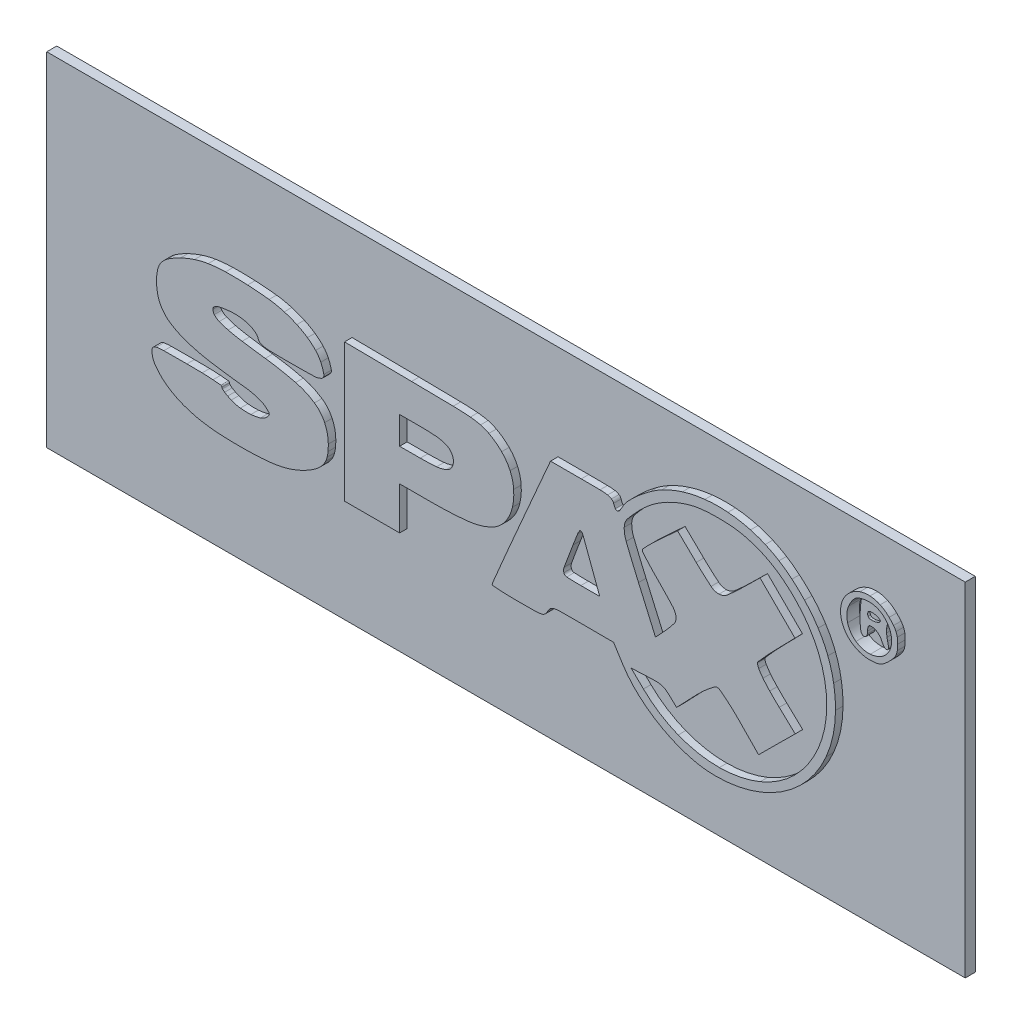
from build123d import *

# Parameters (mm, degrees)
MODEL_W                   = 367
MODEL_H                   = 137
SALIENTE_EXTRUIR1_DEPTH   = 4
SALIENTE_EXTRUIR1_2_DEPTH = 4
SALIENTE_EXTRUIR1_3_DEPTH = 4
SALIENTE_EXTRUIR1_4_DEPTH = 4
SALIENTE_EXTRUIR1_5_DEPTH = 4
SALIENTE_EXTRUIR2_DEPTH   = 7
SALIENTE_EXTRUIR2_2_DEPTH = 7
SALIENTE_EXTRUIR2_3_DEPTH = 7
SALIENTE_EXTRUIR2_4_DEPTH = 7
SALIENTE_EXTRUIR3_DEPTH   = 2
SALIENTE_EXTRUIR4_DEPTH   = 5


with BuildPart() as part:
    # Model → Saliente-Extruir1 (new body)
    with BuildSketch(Plane.XY):
        with Locations((183.5, 68.5)):
            Rectangle(MODEL_W, MODEL_H)
        with BuildLine():
            ThreePointArc((97.89509, 97.457617), (100.444776299, 96.597556375), (102.931345, 95.569169))
            ThreePointArc((102.931345, 95.569169), (105.102908707, 94.464676176), (107.166541, 93.16968))
            ThreePointArc((107.166541, 93.16968), (108.863878371, 91.861487344), (110.418396, 90.386429))
            ThreePointArc((110.418396, 90.386429), (111.583005464, 88.949287405), (112.505954, 87.34621))
            ThreePointArc((112.505954, 87.34621), (113.217849735, 85.568730482), (113.703992, 83.716733))
            ThreePointArc((113.703992, 83.716733), (113.575577736, 82.689303645), (112.860608, 81.940358))
            ThreePointArc((112.860608, 81.940358), (111.392880065, 81.363252337), (109.832213, 81.136108))
            ThreePointArc((109.832213, 81.136108), (105.215994058, 81.03402877), (100.598772, 81))
            ThreePointArc((100.598772, 81), (96.886672981, 81.012669689), (93.174747, 81.050685))
            ThreePointArc((93.174747, 81.050685), (91.591035929, 81.123910451), (90.015443, 81.300006))
            ThreePointArc((90.015443, 81.300006), (89.169923226, 81.503262558), (88.37591, 81.857889))
            ThreePointArc((88.37591, 81.857889), (87.856696942, 82.295169109), (87.534134, 82.892454))
            ThreePointArc((87.534134, 82.892454), (87.01702351, 83.919150051), (86.204428, 84.73229))
            ThreePointArc((86.204428, 84.73229), (84.940116047, 85.508200109), (83.572831, 86.083572))
            ThreePointArc((83.572831, 86.083572), (81.814884484, 86.553218974), (80.012747, 86.804704))
            ThreePointArc((80.012747, 86.804704), (77.970340474, 86.874457144), (75.929557, 86.767253))
            ThreePointArc((75.929557, 86.767253), (74.022477473, 86.535406456), (72.129489, 86.20784))
            ThreePointArc((72.129489, 86.20784), (71.024451517, 85.864619925), (70.014808, 85.299352))
            ThreePointArc((70.014808, 85.299352), (69.548951009, 84.758264963), (69.392505, 84.061614))
            ThreePointArc((69.392505, 84.061614), (69.548113908, 83.257801719), (69.95887, 82.549559))
            ThreePointArc((69.95887, 82.549559), (70.842989698, 81.718363693), (71.903523, 81.128599))
            ThreePointArc((71.903523, 81.128599), (73.664504912, 80.489747225), (75.466863, 79.979165))
            ThreePointArc((75.466863, 79.979165), (78.253261169, 79.362489292), (81.064349, 78.870464))
            ThreePointArc((81.064349, 78.870464), (85.680180626, 78.194285727), (90.303237, 77.569411))
            ThreePointArc((90.303237, 77.569411), (96.418745844, 76.605132076), (102.471757, 75.305002))
            ThreePointArc((102.471757, 75.305002), (106.362399219, 73.980036894), (109.95671, 71.986658))
            ThreePointArc((109.95671, 71.986658), (112.32428237, 69.862291851), (114.034719, 67.180364))
            ThreePointArc((114.034719, 67.180364), (115.129375106, 63.919587043), (115.5, 60.5))
            ThreePointArc((115.5, 60.5), (115.470817654, 59.176709505), (115.383327, 57.855992))
            ThreePointArc((115.383327, 57.855992), (115.244988536, 56.785136325), (115.020934, 55.728884))
            ThreePointArc((115.020934, 55.728884), (114.742516238, 54.817986978), (114.37924, 53.937487))
            ThreePointArc((114.37924, 53.937487), (113.938468483, 53.106760051), (113.418253, 52.32333))
            ThreePointArc((113.418253, 52.32333), (112.070394963, 50.762752015), (110.498998, 49.427523))
            ThreePointArc((110.498998, 49.427523), (108.317294081, 47.96880902), (106.031303, 46.679653))
            ThreePointArc((106.031303, 46.679653), (103.446783059, 45.464419834), (100.781488, 44.43839))
            ThreePointArc((100.781488, 44.43839), (98.134802313, 43.643709635), (95.433355, 43.061778))
            ThreePointArc((95.433355, 43.061778), (92.17775664, 42.589356349), (88.900642, 42.301915))
            ThreePointArc((88.900642, 42.301915), (84.743706488, 42.11463805), (80.583135, 42.045137))
            ThreePointArc((80.583135, 42.045137), (76.402918294, 42.093702528), (72.225754, 42.260642))
            ThreePointArc((72.225754, 42.260642), (68.878642284, 42.532885282), (65.55115, 42.98573))
            ThreePointArc((65.55115, 42.98573), (61.479861274, 43.858257934), (57.512985, 45.123402))
            ThreePointArc((57.512985, 45.123402), (54.090064098, 46.668098382), (50.901745, 48.65231))
            ThreePointArc((50.901745, 48.65231), (48.529453573, 50.669901915), (46.517012, 53.046564))
            ThreePointArc((46.517012, 53.046564), (45.393372944, 55.2802035), (45.003738, 57.75))
            ThreePointArc((45.003738, 57.75), (45.135261616, 58.438467642), (45.513272, 59.028717))
            ThreePointArc((45.513272, 59.028717), (46.103490165, 59.475466468), (46.805622, 59.709888))
            ThreePointArc((46.805622, 59.709888), (48.288834429, 59.891280003), (49.781497, 59.960422))
            ThreePointArc((49.781497, 59.960422), (54.390706013, 59.990107063), (59, 60))
            ThreePointArc((59, 60), (62.04361427, 59.984479082), (65.086912, 59.937921))
            ThreePointArc((65.086912, 59.937921), (67.254826602, 59.864116802), (69.419923, 59.731232))
            ThreePointArc((69.419923, 59.731232), (70.995551703, 59.59746222), (72.568268, 59.432952))
            ThreePointArc((72.568268, 59.432952), (72.876382333, 59.273252346), (73, 58.948973))
            ThreePointArc((73, 58.948973), (73.057684641, 58.675374266), (73.220918, 58.448353))
            ThreePointArc((73.220918, 58.448353), (73.645577971, 58.085215547), (74.092702, 57.750126))
            ThreePointArc((74.092702, 57.750126), (74.682415387, 57.364059421), (75.295145, 57.015675))
            ThreePointArc((75.295145, 57.015675), (75.999939345, 56.663676811), (76.719837, 56.3437))
            ThreePointArc((76.719837, 56.3437), (78.511013106, 55.736162708), (80.368573, 55.379954))
            ThreePointArc((80.368573, 55.379954), (82.471813466, 55.230523067), (84.579494, 55.290796))
            ThreePointArc((84.579494, 55.290796), (86.51708365, 55.544048629), (88.418258, 55.995631))
            ThreePointArc((88.418258, 55.995631), (89.728953262, 56.568631417), (90.853065, 57.453292))
            ThreePointArc((90.853065, 57.453292), (91.317361959, 57.95808782), (91.74725, 58.492491))
            ThreePointArc((91.74725, 58.492491), (91.895854733, 58.808705535), (91.906087, 59.157948))
            ThreePointArc((91.906087, 59.157948), (91.778876123, 59.52369892), (91.543687, 59.831339))
            ThreePointArc((91.543687, 59.831339), (90.894383482, 60.425466565), (90.224079, 60.995795))
            ThreePointArc((90.224079, 60.995795), (89.609507035, 61.432166809), (88.940389, 61.779154))
            ThreePointArc((88.940389, 61.779154), (87.963683725, 62.172095308), (86.967617, 62.512987))
            ThreePointArc((86.967617, 62.512987), (85.813367011, 62.843103226), (84.644169, 63.115584))
            ThreePointArc((84.644169, 63.115584), (83.438606069, 63.336014829), (82.224079, 63.500014))
            ThreePointArc((82.224079, 63.500014), (75.12384142, 64.383742012), (68.048812, 65.450657))
            ThreePointArc((68.048812, 65.450657), (63.3281745, 66.421483701), (58.700849, 67.768622))
            ThreePointArc((58.700849, 67.768622), (55.518991635, 69.062756809), (52.524172, 70.745034))
            ThreePointArc((52.524172, 70.745034), (50.386098374, 72.515983093), (48.717788, 74.735073))
            ThreePointArc((48.717788, 74.735073), (47.880504769, 76.469220421), (47.321521, 78.312003))
            ThreePointArc((47.321521, 78.312003), (46.969167844, 80.457753628), (46.850641, 82.629009))
            ThreePointArc((46.850641, 82.629009), (46.965997341, 84.725026768), (47.312436, 86.795432))
            ThreePointArc((47.312436, 86.795432), (47.854451459, 88.418610872), (48.711347, 89.899901))
            ThreePointArc((48.711347, 89.899901), (50.000998097, 91.380885307), (51.537218, 92.604218))
            ThreePointArc((51.537218, 92.604218), (53.912861215, 94.055494269), (56.379506, 95.346055))
            ThreePointArc((56.379506, 95.346055), (59.164667649, 96.577750213), (62.023915, 97.626036))
            ThreePointArc((62.023915, 97.626036), (64.736876752, 98.400613662), (67.503968, 98.951375))
            ThreePointArc((67.503968, 98.951375), (70.959690911, 99.373379491), (74.436153, 99.558636))
            ThreePointArc((74.436153, 99.558636), (78.841896801, 99.567658734), (83.245386, 99.42644))
            ThreePointArc((83.245386, 99.42644), (87.543611742, 99.142488444), (91.829825, 98.713829))
            ThreePointArc((91.829825, 98.713829), (94.890016279, 98.218782784), (97.89509, 97.457617))
        make_face(mode=Mode.SUBTRACT)
        with BuildLine():
            ThreePointArc((171.275076, 61.718433), (164.306026908, 61.179727941), (157.318499, 61))
            Line((157.318499, 61), (144, 61))
            Line((144, 61), (144, 44))
            Line((144, 44), (122, 44))
            Line((122, 44), (122, 99.119291))
            Line((122, 99.119291), (148.75, 98.809646))
            ThreePointArc((148.75, 98.809646), (157.081469734, 98.700396012), (165.412564, 98.565519))
            ThreePointArc((165.412564, 98.565519), (168.835102049, 98.450039203), (172.252192, 98.225098))
            ThreePointArc((172.252192, 98.225098), (174.30257356, 97.973610726), (176.326044, 97.557825))
            ThreePointArc((176.326044, 97.557825), (178.030501311, 97.021242966), (179.655474, 96.2779))
            ThreePointArc((179.655474, 96.2779), (182.352634405, 94.570847489), (184.771872, 92.488543))
            ThreePointArc((184.771872, 92.488543), (186.67614225, 90.209938725), (188.137833, 87.625032))
            ThreePointArc((188.137833, 87.625032), (189.116328654, 84.803619752), (189.573535, 81.852555))
            ThreePointArc((189.573535, 81.852555), (189.549890982, 78.616931261), (189.068878, 75.417174))
            ThreePointArc((189.068878, 75.417174), (187.853250507, 71.848145284), (185.900182, 68.62305))
            ThreePointArc((185.900182, 68.62305), (183.373056049, 66.045983765), (180.294502, 64.161802))
            ThreePointArc((180.294502, 64.161802), (175.8837711, 62.574736043), (171.275076, 61.718433))
        make_face(mode=Mode.SUBTRACT)
        with BuildLine():
            ThreePointArc((239.779111, 35.375969), (236.105882636, 39.12266297), (233, 43.351589))
            Line((233, 43.351589), (229.5, 48.903895))
            Line((229.5, 48.903895), (216.910515, 48.951948))
            ThreePointArc((216.910515, 48.951948), (212.779724601, 48.956111332), (208.648976, 48.937068))
            ThreePointArc((208.648976, 48.937068), (207.213960958, 48.865618775), (205.790127, 48.673083))
            ThreePointArc((205.790127, 48.673083), (204.981735104, 48.413893271), (204.270399, 47.95056))
            ThreePointArc((204.270399, 47.95056), (203.647464763, 47.284342291), (203.181954, 46.5))
            ThreePointArc((203.181954, 46.5), (202.738611643, 45.731923216), (202.156892, 45.062523))
            ThreePointArc((202.156892, 45.062523), (201.518577712, 44.60455888), (200.780131, 44.336468))
            ThreePointArc((200.780131, 44.336468), (199.53409447, 44.132552343), (198.274087, 44.051498))
            ThreePointArc((198.274087, 44.051498), (194.897861181, 44.012875077), (191.521439, 44))
            ThreePointArc((191.521439, 44), (189.504137229, 44.012675794), (187.487154, 44.050699))
            ThreePointArc((187.487154, 44.050699), (185.788096336, 44.111177481), (184.090673, 44.207139))
            ThreePointArc((184.090673, 44.207139), (182.675308241, 44.308135781), (181.260868, 44.421346))
            ThreePointArc((181.260868, 44.421346), (181.075124451, 44.512411762), (181, 44.705155))
            ThreePointArc((181, 44.705155), (181.027607758, 44.980527094), (181.109332, 45.244938))
            Line((181.109332, 45.244938), (184.420522, 53.074156))
            ThreePointArc((184.420522, 53.074156), (186.293976623, 57.480794427), (188.180229, 61.88197))
            Line((188.180229, 61.88197), (192.644331, 72.205155))
            Line((192.644331, 72.205155), (204.288661, 99))
            Line((204.288661, 99), (216.576943, 99))
            ThreePointArc((216.576943, 99), (220.317245151, 98.987606089), (224.057383, 98.950422))
            ThreePointArc((224.057383, 98.950422), (225.581249488, 98.876721039), (227.096203, 98.696397))
            ThreePointArc((227.096203, 98.696397), (227.906918414, 98.482262304), (228.65542, 98.104296))
            ThreePointArc((228.65542, 98.104296), (229.174077495, 97.625851118), (229.5, 97))
            ThreePointArc((229.5, 97), (229.798344799, 96.221330865), (230.185638, 95.48286))
            ThreePointArc((230.185638, 95.48286), (230.523537363, 95.180947078), (230.972891, 95.122563))
            ThreePointArc((230.972891, 95.122563), (231.489196338, 95.321864885), (231.888979, 95.704574))
            ThreePointArc((231.888979, 95.704574), (232.503281328, 96.642068308), (233.061127, 97.614216))
            ThreePointArc((233.061127, 97.614216), (234.074201552, 99.231212662), (235.29801, 100.695211))
            ThreePointArc((235.29801, 100.695211), (237.291847949, 102.683108862), (239.37243, 104.580029))
            ThreePointArc((239.37243, 104.580029), (241.704789564, 106.52210935), (244.122461, 108.356896))
            ThreePointArc((244.122461, 108.356896), (246.357881525, 109.868303172), (248.685597, 111.233293))
            ThreePointArc((248.685597, 111.233293), (252.75506448, 113.19239205), (256.998615, 114.73865))
            ThreePointArc((256.998615, 114.73865), (261.438425803, 115.883547559), (265.966723, 116.602738))
            ThreePointArc((265.966723, 116.602738), (270.566138345, 116.892392642), (275.172384, 116.747402))
            ThreePointArc((275.172384, 116.747402), (279.718965517, 116.16866996), (284.189216, 115.157139))
            ThreePointArc((284.189216, 115.157139), (287.176762343, 114.213297932), (290.089809, 113.059856))
            ThreePointArc((290.089809, 113.059856), (292.881459471, 111.714058106), (295.566942, 110.167233))
            ThreePointArc((295.566942, 110.167233), (298.2248954, 108.370147666), (300.749659, 106.390299))
            ThreePointArc((300.749659, 106.390299), (303.327516064, 104.090218723), (305.771367, 101.64823))
            ThreePointArc((305.771367, 101.64823), (308.656650042, 98.29891621), (311.218992, 94.696533))
            ThreePointArc((311.218992, 94.696533), (313.357733991, 90.971837627), (315.1092, 87.050111))
            ThreePointArc((315.1092, 87.050111), (316.470901091, 82.932614249), (317.414446, 78.69968))
            ThreePointArc((317.414446, 78.69968), (317.98346645, 74.195289034), (318.15781, 69.658448))
            ThreePointArc((318.15781, 69.658448), (317.190509028, 60.526349584), (314.422737, 51.77019))
            ThreePointArc((314.422737, 51.77019), (309.952116696, 43.681081751), (303.985801, 36.622527))
            ThreePointArc((303.985801, 36.622527), (296.700003431, 30.811535346), (288.427385, 26.520352))
            ThreePointArc((288.427385, 26.520352), (279.43924588, 23.885002503), (270.11351, 23.011869))
            ThreePointArc((270.11351, 23.011869), (264.818740399, 23.392292132), (259.626977, 24.499044))
            ThreePointArc((259.626977, 24.499044), (254.230732451, 26.375908187), (249.075793, 28.839376))
            ThreePointArc((249.075793, 28.839376), (244.245100665, 31.848322962), (239.779111, 35.375969))
        make_face(mode=Mode.SUBTRACT)
        with BuildLine():
            ThreePointArc((339.6, 112.6), (340.501822247, 111.65073337), (341.353833, 110.656516))
            ThreePointArc((341.353833, 110.656516), (341.902405139, 109.883771356), (342.345238, 109.045938))
            ThreePointArc((342.345238, 109.045938), (342.655044194, 108.196448038), (342.841588, 107.31168))
            ThreePointArc((342.841588, 107.31168), (342.960350312, 106.158550667), (343, 105))
            ThreePointArc((343, 105), (342.960350312, 103.841449333), (342.841588, 102.68832))
            ThreePointArc((342.841588, 102.68832), (342.655044194, 101.803551962), (342.345238, 100.954062))
            ThreePointArc((342.345238, 100.954062), (341.902405139, 100.116228644), (341.353833, 99.343484))
            ThreePointArc((341.353833, 99.343484), (340.501822247, 98.34926663), (339.6, 97.4))
            ThreePointArc((339.6, 97.4), (338.632669788, 96.480907495), (337.619632, 95.612453))
            ThreePointArc((337.619632, 95.612453), (336.844834079, 95.065887145), (336.002408, 94.630727))
            ThreePointArc((336.002408, 94.630727), (335.130146874, 94.326044941), (334.2232, 94.149642))
            ThreePointArc((334.2232, 94.149642), (332.981277198, 94.037444874), (331.734859, 94))
            ThreePointArc((331.734859, 94), (328.290479936, 94.501704687), (325.132342, 95.965132))
            ThreePointArc((325.132342, 95.965132), (322.604525834, 98.241866266), (320.889488, 101.179896))
            ThreePointArc((320.889488, 101.179896), (320.174732681, 104.450317237), (320.515643, 107.780529))
            ThreePointArc((320.515643, 107.780529), (321.877799547, 110.886710221), (324.11073, 113.439719))
            ThreePointArc((324.11073, 113.439719), (325.880428663, 114.677067568), (327.841843, 115.580239))
            ThreePointArc((327.841843, 115.580239), (329.865763169, 116.082200887), (331.948897, 116.17586))
            ThreePointArc((331.948897, 116.17586), (334.02942473, 115.857120166), (336.008244, 115.139858))
            ThreePointArc((336.008244, 115.139858), (337.912262804, 114.022856991), (339.6, 112.6))
        make_face(mode=Mode.SUBTRACT)
    extrude(amount=SALIENTE_EXTRUIR1_DEPTH)



with BuildPart() as body_2:
    # Model → Saliente-Extruir1 2 (new body)
    with BuildSketch(Plane.XY):
        with BuildLine():
            ThreePointArc((234.51169, 86.356391), (236.939993562, 80.440385504), (239.4571, 74.561614))
            Line((239.4571, 74.561614), (246.22639, 59.075076))
            Line((246.22639, 59.075076), (250.110038, 63.239911))
            ThreePointArc((250.110038, 63.239911), (251.987653471, 65.369915405), (253.743234, 67.601573))
            ThreePointArc((253.743234, 67.601573), (254.341002642, 68.851587105), (254.425489, 70.2346))
            ThreePointArc((254.425489, 70.2346), (254.00299519, 71.706076314), (253.169425, 72.990173))
            ThreePointArc((253.169425, 72.990173), (250.676788874, 75.728790617), (248.105547, 78.393744))
            ThreePointArc((248.105547, 78.393744), (246.736411979, 79.787007115), (245.382367, 81.19494))
            ThreePointArc((245.382367, 81.19494), (244.224550826, 82.43211461), (243.087254, 83.688178))
            ThreePointArc((243.087254, 83.688178), (242.138178293, 84.761898494), (241.197141, 85.842671))
            ThreePointArc((241.197141, 85.842671), (241.050883489, 86.089738417), (241, 86.372306))
            ThreePointArc((241, 86.372306), (241.082897444, 86.82059458), (241.320626, 87.209593))
            ThreePointArc((241.320626, 87.209593), (242.238293761, 88.208933851), (243.178507, 89.187093))
            ThreePointArc((243.178507, 89.187093), (244.644951364, 90.646871396), (246.14217, 92.075069))
            ThreePointArc((246.14217, 92.075069), (248.704344592, 94.455833269), (251.278102, 96.824071))
            Line((251.278102, 96.824071), (255.056204, 100.283501))
            Line((255.056204, 100.283501), (262.500164, 93.065496))
            ThreePointArc((262.500164, 93.065496), (265.419029622, 90.344013715), (268.442154, 87.738834))
            ThreePointArc((268.442154, 87.738834), (269.934218851, 86.906898932), (271.625227, 86.664278))
            ThreePointArc((271.625227, 86.664278), (273.349125796, 87.029016869), (274.856476, 87.941572))
            ThreePointArc((274.856476, 87.941572), (278.099840365, 90.833381683), (281.25, 93.826452))
            Line((281.25, 93.826452), (288, 100.446361))
            Line((288, 100.446361), (294.977731, 93.522098))
            Line((294.977731, 93.522098), (301.955463, 86.597835))
            Line((301.955463, 86.597835), (294.477731, 78.913754))
            ThreePointArc((294.477731, 78.913754), (293.038471082, 77.422482094), (291.611599, 75.919353))
            ThreePointArc((291.611599, 75.919353), (290.39561254, 74.610931763), (289.196584, 73.286953))
            ThreePointArc((289.196584, 73.286953), (288.179881049, 72.144274894), (287.168553, 70.996837))
            ThreePointArc((287.168553, 70.996837), (287.043533769, 70.788303649), (287, 70.549095))
            ThreePointArc((287, 70.549095), (287.121205099, 69.649345269), (287.476178, 68.813741))
            ThreePointArc((287.476178, 68.813741), (288.287068081, 67.542884725), (289.178372, 66.327074))
            ThreePointArc((289.178372, 66.327074), (290.480929376, 64.751633309), (291.863447, 63.245873))
            ThreePointArc((291.863447, 63.245873), (293.741562948, 61.349481392), (295.664123, 59.498162))
            Line((295.664123, 59.498162), (302.046691, 53.496324))
            Line((302.046691, 53.496324), (294.733946, 46.232385))
            Line((294.733946, 46.232385), (287.421202, 38.968446))
            Line((287.421202, 38.968446), (280.081295, 46.484223))
            ThreePointArc((280.081295, 46.484223), (278.625025699, 47.94091597), (277.135093, 49.363159))
            ThreePointArc((277.135093, 49.363159), (275.764522774, 50.600242631), (274.354565, 51.79224))
            ThreePointArc((274.354565, 51.79224), (273.171155452, 52.735404251), (271.964155, 53.648184))
            ThreePointArc((271.964155, 53.648184), (271.45680364, 53.909793445), (270.893148, 54))
            ThreePointArc((270.893148, 54), (270.331449049, 53.909128763), (269.827055, 53.645785))
            ThreePointArc((269.827055, 53.645785), (268.638485823, 52.733564375), (267.474115, 51.790652))
            ThreePointArc((267.474115, 51.790652), (266.08707827, 50.597824574), (264.740216, 49.359814))
            ThreePointArc((264.740216, 49.359814), (263.277579752, 47.936544949), (261.849285, 46.478816))
            Line((261.849285, 46.478816), (254.653661, 38.957632))
            Line((254.653661, 38.957632), (251.968468, 41.53021))
            ThreePointArc((251.968468, 41.53021), (251.134217606, 42.265198483), (250.241566, 42.928037))
            ThreePointArc((250.241566, 42.928037), (249.488627397, 43.348228458), (248.673779, 43.630185))
            ThreePointArc((248.673779, 43.630185), (247.64971719, 43.821064065), (246.61005, 43.886099))
            ThreePointArc((246.61005, 43.886099), (244.750328485, 43.866376755), (242.891638, 43.801394))
            Line((242.891638, 43.801394), (236.5, 43.5))
            Line((236.5, 43.5), (241.42227, 38.718865))
            ThreePointArc((241.42227, 38.718865), (247.919417785, 33.549751628), (255.304942, 29.756772))
            ThreePointArc((255.304942, 29.756772), (263.371500003, 27.43740264), (271.731922, 26.694317))
            ThreePointArc((271.731922, 26.694317), (280.079454103, 27.554658545), (288.110944, 29.987075))
            ThreePointArc((288.110944, 29.987075), (295.43831678, 33.88293459), (301.857143, 39.142857))
            ThreePointArc((301.857143, 39.142857), (307.264262026, 45.711138026), (311.308773, 53.195868))
            ThreePointArc((311.308773, 53.195868), (313.800570664, 61.25849054), (314.657457, 69.653768))
            ThreePointArc((314.657457, 69.653768), (313.845493433, 78.039631654), (311.396176, 86.100825))
            ThreePointArc((311.396176, 86.100825), (307.394951704, 93.571510472), (302.02185, 100.12519))
            ThreePointArc((302.02185, 100.12519), (299.793273975, 102.241903239), (297.454132, 104.235754))
            ThreePointArc((297.454132, 104.235754), (295.232852331, 105.898153627), (292.896209, 107.394066))
            ThreePointArc((292.896209, 107.394066), (290.503237925, 108.687447768), (288.02024, 109.798244))
            ThreePointArc((288.02024, 109.798244), (285.288271903, 110.803794267), (282.5, 111.640646))
            ThreePointArc((282.5, 111.640646), (279.96076598, 112.209018845), (277.383638, 112.568419))
            ThreePointArc((277.383638, 112.568419), (274.29915905, 112.794914592), (271.207297, 112.870411))
            ThreePointArc((271.207297, 112.870411), (268.125347626, 112.794890196), (265.050782, 112.568701))
            ThreePointArc((265.050782, 112.568701), (262.505889422, 112.21038982), (260, 111.639966))
            ThreePointArc((260, 111.639966), (257.253357478, 110.798501546), (254.565122, 109.785833))
            ThreePointArc((254.565122, 109.785833), (251.974835187, 108.61580809), (249.466042, 107.279956))
            ThreePointArc((249.466042, 107.279956), (247.067791784, 105.794491212), (244.771966, 104.155164))
            ThreePointArc((244.771966, 104.155164), (242.597300254, 102.37492684), (240.545309, 100.454576))
            ThreePointArc((240.545309, 100.454576), (237.771874557, 97.544481246), (235.141444, 94.50451))
            ThreePointArc((235.141444, 94.50451), (234.142657499, 92.789858214), (233.741004, 90.846593))
            ThreePointArc((233.741004, 90.846593), (233.887490705, 88.560495358), (234.51169, 86.356391))
        make_face()
    extrude(amount=SALIENTE_EXTRUIR1_2_DEPTH)


with BuildPart() as body_3:
    # Model → Saliente-Extruir1 3 (new body)
    with BuildSketch(Plane.XY):
        with BuildLine():
            ThreePointArc((210.745781, 62.148912), (213.575640978, 62.037233298), (216.407459, 62))
            Line((216.407459, 62), (223.949694, 62))
            Line((223.949694, 62), (221.063652, 69.75))
            Line((221.063652, 69.75), (219.890024, 72.897158))
            Line((219.890024, 72.897158), (218.750176, 75.94473))
            Line((218.750176, 75.94473), (217.77347, 78.548354))
            Line((217.77347, 78.548354), (217.240727, 79.955464))
            ThreePointArc((217.240727, 79.955464), (216.980093899, 80.439013159), (216.604024, 80.839414))
            ThreePointArc((216.604024, 80.839414), (216.269421607, 80.935209877), (215.970403, 80.757099))
            ThreePointArc((215.970403, 80.757099), (215.506154055, 80.023375365), (215.135296, 79.238301))
            ThreePointArc((215.135296, 79.238301), (214.192446019, 76.850464083), (213.267943, 74.455464))
            ThreePointArc((213.267943, 74.455464), (211.477410462, 69.723514285), (209.713528, 64.981566))
            ThreePointArc((209.713528, 64.981566), (209.519260228, 64.038945584), (209.612337, 63.081026))
            ThreePointArc((209.612337, 63.081026), (210.025738364, 62.428532197), (210.745781, 62.148912))
        make_face()
    extrude(amount=SALIENTE_EXTRUIR1_3_DEPTH)


with BuildPart() as body_4:
    # Model → Saliente-Extruir1 4 (new body)
    with BuildSketch(Plane.XY):
        with BuildLine():
            Line((144, 85), (144, 74))
            Line((144, 74), (152.25, 74.014742))
            ThreePointArc((152.25, 74.014742), (155.509024671, 74.08445091), (158.762814, 74.281824))
            ThreePointArc((158.762814, 74.281824), (160.735248024, 74.596622292), (162.634723, 75.214351))
            ThreePointArc((162.634723, 75.214351), (163.802916508, 75.914163807), (164.717742, 76.92288))
            ThreePointArc((164.717742, 76.92288), (165.5, 79.5), (164.717742, 82.07712))
            ThreePointArc((164.717742, 82.07712), (163.802916508, 83.085836193), (162.634723, 83.785649))
            ThreePointArc((162.634723, 83.785649), (160.735248024, 84.403377708), (158.762814, 84.718176))
            ThreePointArc((158.762814, 84.718176), (155.509024671, 84.91554909), (152.25, 84.985258))
            Line((152.25, 84.985258), (144, 85))
        make_face()
    extrude(amount=SALIENTE_EXTRUIR1_4_DEPTH)


with BuildPart() as body_5:
    # Model → Saliente-Extruir1 5 (new body)
    with BuildSketch(Plane.XY):
        with BuildLine():
            ThreePointArc((329.156275, 108.222533), (329.039515006, 107.86962007), (329, 107.5))
            ThreePointArc((329, 107.5), (329.039515221, 107.130379976), (329.156275, 106.777467))
            ThreePointArc((329.156275, 106.777467), (329.33435515, 106.512823122), (329.589081, 106.320824))
            ThreePointArc((329.589081, 106.320824), (329.960480225, 106.178664013), (330.354404, 106.124158))
            ThreePointArc((330.354404, 106.124158), (330.943844998, 106.132114624), (331.531089, 106.183578))
            ThreePointArc((331.531089, 106.183578), (332.019211122, 106.262948528), (332.50017, 106.37802))
            ThreePointArc((332.50017, 106.37802), (332.917817809, 106.518116787), (333.318671, 106.700801))
            ThreePointArc((333.318671, 106.700801), (333.613259513, 106.879049322), (333.882451, 107.093737))
            ThreePointArc((333.882451, 107.093737), (334.062179, 107.5), (333.882451, 107.906263))
            ThreePointArc((333.882451, 107.906263), (333.613259513, 108.120950678), (333.318671, 108.299199))
            ThreePointArc((333.318671, 108.299199), (332.917817809, 108.481883213), (332.50017, 108.62198))
            ThreePointArc((332.50017, 108.62198), (332.019211122, 108.737051472), (331.531089, 108.816422))
            ThreePointArc((331.531089, 108.816422), (330.943844998, 108.867885376), (330.354404, 108.875842))
            ThreePointArc((330.354404, 108.875842), (329.960480225, 108.821335987), (329.589081, 108.679176))
            ThreePointArc((329.589081, 108.679176), (329.33435515, 108.487176878), (329.156275, 108.222533))
        make_face()
    extrude(amount=SALIENTE_EXTRUIR1_5_DEPTH)


with BuildPart() as body_6:
    # Model<3> → Saliente-Extruir2 (new body)
    with BuildSketch(Plane.XY):
        with BuildLine():
            Line((229.5, 48.903895), (233, 43.351589))
            ThreePointArc((233, 43.351589), (236.105882636, 39.12266297), (239.779111, 35.375969))
            ThreePointArc((239.779111, 35.375969), (244.245100665, 31.848322962), (249.075793, 28.839376))
            ThreePointArc((249.075793, 28.839376), (254.230732451, 26.375908187), (259.626977, 24.499044))
            ThreePointArc((259.626977, 24.499044), (264.818740399, 23.392292132), (270.11351, 23.011869))
            ThreePointArc((270.11351, 23.011869), (279.43924588, 23.885002503), (288.427385, 26.520352))
            ThreePointArc((288.427385, 26.520352), (296.700003431, 30.811535346), (303.985801, 36.622527))
            ThreePointArc((303.985801, 36.622527), (309.952116696, 43.681081751), (314.422737, 51.77019))
            ThreePointArc((314.422737, 51.77019), (317.190509028, 60.526349584), (318.15781, 69.658448))
            ThreePointArc((318.15781, 69.658448), (317.98346645, 74.195289034), (317.414446, 78.69968))
            ThreePointArc((317.414446, 78.69968), (316.470901091, 82.932614249), (315.1092, 87.050111))
            ThreePointArc((315.1092, 87.050111), (313.357733991, 90.971837627), (311.218992, 94.696533))
            ThreePointArc((311.218992, 94.696533), (308.656650042, 98.29891621), (305.771367, 101.64823))
            ThreePointArc((305.771367, 101.64823), (303.327516064, 104.090218723), (300.749659, 106.390299))
            ThreePointArc((300.749659, 106.390299), (298.2248954, 108.370147666), (295.566942, 110.167233))
            ThreePointArc((295.566942, 110.167233), (292.881459471, 111.714058106), (290.089809, 113.059856))
            ThreePointArc((290.089809, 113.059856), (287.176762343, 114.213297932), (284.189216, 115.157139))
            ThreePointArc((284.189216, 115.157139), (279.718965517, 116.16866996), (275.172384, 116.747402))
            ThreePointArc((275.172384, 116.747402), (270.566138345, 116.892392642), (265.966723, 116.602738))
            ThreePointArc((265.966723, 116.602738), (261.438425803, 115.883547559), (256.998615, 114.73865))
            ThreePointArc((256.998615, 114.73865), (252.75506448, 113.19239205), (248.685597, 111.233293))
            ThreePointArc((248.685597, 111.233293), (246.357881525, 109.868303172), (244.122461, 108.356896))
            ThreePointArc((244.122461, 108.356896), (241.704789564, 106.52210935), (239.37243, 104.580029))
            ThreePointArc((239.37243, 104.580029), (237.291847949, 102.683108862), (235.29801, 100.695211))
            ThreePointArc((235.29801, 100.695211), (234.074201552, 99.231212662), (233.061127, 97.614216))
            ThreePointArc((233.061127, 97.614216), (232.503281328, 96.642068308), (231.888979, 95.704574))
            ThreePointArc((231.888979, 95.704574), (231.489196338, 95.321864885), (230.972891, 95.122563))
            ThreePointArc((230.972891, 95.122563), (230.523537363, 95.180947078), (230.185638, 95.48286))
            ThreePointArc((230.185638, 95.48286), (229.798344799, 96.221330865), (229.5, 97))
            ThreePointArc((229.5, 97), (229.174077495, 97.625851118), (228.65542, 98.104296))
            ThreePointArc((228.65542, 98.104296), (227.906918414, 98.482262304), (227.096203, 98.696397))
            ThreePointArc((227.096203, 98.696397), (225.581249488, 98.876721039), (224.057383, 98.950422))
            ThreePointArc((224.057383, 98.950422), (220.317245151, 98.987606089), (216.576943, 99))
            Line((216.576943, 99), (204.288661, 99))
            Line((204.288661, 99), (192.644331, 72.205155))
            Line((192.644331, 72.205155), (188.180229, 61.88197))
            ThreePointArc((188.180229, 61.88197), (186.293976623, 57.480794427), (184.420522, 53.074156))
            Line((184.420522, 53.074156), (181.109332, 45.244938))
            ThreePointArc((181.109332, 45.244938), (181.027607758, 44.980527094), (181, 44.705155))
            ThreePointArc((181, 44.705155), (181.075124451, 44.512411762), (181.260868, 44.421346))
            ThreePointArc((181.260868, 44.421346), (182.675308241, 44.308135781), (184.090673, 44.207139))
            ThreePointArc((184.090673, 44.207139), (185.788096336, 44.111177481), (187.487154, 44.050699))
            ThreePointArc((187.487154, 44.050699), (189.504137229, 44.012675794), (191.521439, 44))
            ThreePointArc((191.521439, 44), (194.897861181, 44.012875077), (198.274087, 44.051498))
            ThreePointArc((198.274087, 44.051498), (199.53409447, 44.132552343), (200.780131, 44.336468))
            ThreePointArc((200.780131, 44.336468), (201.518577712, 44.60455888), (202.156892, 45.062523))
            ThreePointArc((202.156892, 45.062523), (202.738611643, 45.731923216), (203.181954, 46.5))
            ThreePointArc((203.181954, 46.5), (203.647464763, 47.284342291), (204.270399, 47.95056))
            ThreePointArc((204.270399, 47.95056), (204.981735104, 48.413893271), (205.790127, 48.673083))
            ThreePointArc((205.790127, 48.673083), (207.213960958, 48.865618775), (208.648976, 48.937068))
            ThreePointArc((208.648976, 48.937068), (212.779724601, 48.956111332), (216.910515, 48.951948))
            Line((216.910515, 48.951948), (229.5, 48.903895))
        make_face()
        with BuildLine():
            Line((223.949694, 62), (216.407459, 62))
            ThreePointArc((216.407459, 62), (213.575640978, 62.037233298), (210.745781, 62.148912))
            ThreePointArc((210.745781, 62.148912), (210.025738364, 62.428532197), (209.612337, 63.081026))
            ThreePointArc((209.612337, 63.081026), (209.519260228, 64.038945584), (209.713528, 64.981566))
            ThreePointArc((209.713528, 64.981566), (211.477410462, 69.723514285), (213.267943, 74.455464))
            ThreePointArc((213.267943, 74.455464), (214.192446019, 76.850464083), (215.135296, 79.238301))
            ThreePointArc((215.135296, 79.238301), (215.506154055, 80.023375365), (215.970403, 80.757099))
            ThreePointArc((215.970403, 80.757099), (216.269421607, 80.935209877), (216.604024, 80.839414))
            ThreePointArc((216.604024, 80.839414), (216.980093899, 80.439013159), (217.240727, 79.955464))
            Line((217.240727, 79.955464), (217.77347, 78.548354))
            Line((217.77347, 78.548354), (218.750176, 75.94473))
            Line((218.750176, 75.94473), (219.890024, 72.897158))
            Line((219.890024, 72.897158), (221.063652, 69.75))
            Line((221.063652, 69.75), (223.949694, 62))
        make_face(mode=Mode.SUBTRACT)
        with BuildLine():
            Line((246.22639, 59.075076), (239.4571, 74.561614))
            ThreePointArc((239.4571, 74.561614), (236.939993562, 80.440385504), (234.51169, 86.356391))
            ThreePointArc((234.51169, 86.356391), (233.887490705, 88.560495358), (233.741004, 90.846593))
            ThreePointArc((233.741004, 90.846593), (234.142657499, 92.789858214), (235.141444, 94.50451))
            ThreePointArc((235.141444, 94.50451), (237.771874557, 97.544481246), (240.545309, 100.454576))
            ThreePointArc((240.545309, 100.454576), (242.597300254, 102.37492684), (244.771966, 104.155164))
            ThreePointArc((244.771966, 104.155164), (247.067791784, 105.794491212), (249.466042, 107.279956))
            ThreePointArc((249.466042, 107.279956), (251.974835187, 108.61580809), (254.565122, 109.785833))
            ThreePointArc((254.565122, 109.785833), (257.253357478, 110.798501546), (260, 111.639966))
            ThreePointArc((260, 111.639966), (262.505889422, 112.21038982), (265.050782, 112.568701))
            ThreePointArc((265.050782, 112.568701), (268.125347626, 112.794890196), (271.207297, 112.870411))
            ThreePointArc((271.207297, 112.870411), (274.29915905, 112.794914592), (277.383638, 112.568419))
            ThreePointArc((277.383638, 112.568419), (279.96076598, 112.209018845), (282.5, 111.640646))
            ThreePointArc((282.5, 111.640646), (285.288271903, 110.803794267), (288.02024, 109.798244))
            ThreePointArc((288.02024, 109.798244), (290.503237925, 108.687447768), (292.896209, 107.394066))
            ThreePointArc((292.896209, 107.394066), (295.232852331, 105.898153627), (297.454132, 104.235754))
            ThreePointArc((297.454132, 104.235754), (299.793273975, 102.241903239), (302.02185, 100.12519))
            ThreePointArc((302.02185, 100.12519), (307.394951704, 93.571510472), (311.396176, 86.100825))
            ThreePointArc((311.396176, 86.100825), (313.845493433, 78.039631654), (314.657457, 69.653768))
            ThreePointArc((314.657457, 69.653768), (313.800570664, 61.25849054), (311.308773, 53.195868))
            ThreePointArc((311.308773, 53.195868), (307.264262026, 45.711138026), (301.857143, 39.142857))
            ThreePointArc((301.857143, 39.142857), (295.43831678, 33.88293459), (288.110944, 29.987075))
            ThreePointArc((288.110944, 29.987075), (280.079454103, 27.554658545), (271.731922, 26.694317))
            ThreePointArc((271.731922, 26.694317), (263.371500003, 27.43740264), (255.304942, 29.756772))
            ThreePointArc((255.304942, 29.756772), (247.919417785, 33.549751628), (241.42227, 38.718865))
            Line((241.42227, 38.718865), (236.5, 43.5))
            Line((236.5, 43.5), (242.891638, 43.801394))
            ThreePointArc((242.891638, 43.801394), (244.750328485, 43.866376755), (246.61005, 43.886099))
            ThreePointArc((246.61005, 43.886099), (247.64971719, 43.821064065), (248.673779, 43.630185))
            ThreePointArc((248.673779, 43.630185), (249.488627397, 43.348228458), (250.241566, 42.928037))
            ThreePointArc((250.241566, 42.928037), (251.134217606, 42.265198483), (251.968468, 41.53021))
            Line((251.968468, 41.53021), (254.653661, 38.957632))
            Line((254.653661, 38.957632), (261.849285, 46.478816))
            ThreePointArc((261.849285, 46.478816), (263.277579752, 47.936544949), (264.740216, 49.359814))
            ThreePointArc((264.740216, 49.359814), (266.08707827, 50.597824574), (267.474115, 51.790652))
            ThreePointArc((267.474115, 51.790652), (268.638485823, 52.733564375), (269.827055, 53.645785))
            ThreePointArc((269.827055, 53.645785), (270.331449049, 53.909128763), (270.893148, 54))
            ThreePointArc((270.893148, 54), (271.45680364, 53.909793445), (271.964155, 53.648184))
            ThreePointArc((271.964155, 53.648184), (273.171155452, 52.735404251), (274.354565, 51.79224))
            ThreePointArc((274.354565, 51.79224), (275.764522774, 50.600242631), (277.135093, 49.363159))
            ThreePointArc((277.135093, 49.363159), (278.625025699, 47.94091597), (280.081295, 46.484223))
            Line((280.081295, 46.484223), (287.421202, 38.968446))
            Line((287.421202, 38.968446), (294.733946, 46.232385))
            Line((294.733946, 46.232385), (302.046691, 53.496324))
            Line((302.046691, 53.496324), (295.664123, 59.498162))
            ThreePointArc((295.664123, 59.498162), (293.741562948, 61.349481392), (291.863447, 63.245873))
            ThreePointArc((291.863447, 63.245873), (290.480929376, 64.751633309), (289.178372, 66.327074))
            ThreePointArc((289.178372, 66.327074), (288.287068081, 67.542884725), (287.476178, 68.813741))
            ThreePointArc((287.476178, 68.813741), (287.121205099, 69.649345269), (287, 70.549095))
            ThreePointArc((287, 70.549095), (287.043533769, 70.788303649), (287.168553, 70.996837))
            ThreePointArc((287.168553, 70.996837), (288.179881049, 72.144274894), (289.196584, 73.286953))
            ThreePointArc((289.196584, 73.286953), (290.39561254, 74.610931763), (291.611599, 75.919353))
            ThreePointArc((291.611599, 75.919353), (293.038471082, 77.422482094), (294.477731, 78.913754))
            Line((294.477731, 78.913754), (301.955463, 86.597835))
            Line((301.955463, 86.597835), (294.977731, 93.522098))
            Line((294.977731, 93.522098), (288, 100.446361))
            Line((288, 100.446361), (281.25, 93.826452))
            ThreePointArc((281.25, 93.826452), (278.099840365, 90.833381683), (274.856476, 87.941572))
            ThreePointArc((274.856476, 87.941572), (273.349125796, 87.029016869), (271.625227, 86.664278))
            ThreePointArc((271.625227, 86.664278), (269.934218851, 86.906898932), (268.442154, 87.738834))
            ThreePointArc((268.442154, 87.738834), (265.419029622, 90.344013715), (262.500164, 93.065496))
            Line((262.500164, 93.065496), (255.056204, 100.283501))
            Line((255.056204, 100.283501), (251.278102, 96.824071))
            ThreePointArc((251.278102, 96.824071), (248.704344592, 94.455833269), (246.14217, 92.075069))
            ThreePointArc((246.14217, 92.075069), (244.644951364, 90.646871396), (243.178507, 89.187093))
            ThreePointArc((243.178507, 89.187093), (242.238293761, 88.208933851), (241.320626, 87.209593))
            ThreePointArc((241.320626, 87.209593), (241.082897444, 86.82059458), (241, 86.372306))
            ThreePointArc((241, 86.372306), (241.050883489, 86.089738417), (241.197141, 85.842671))
            ThreePointArc((241.197141, 85.842671), (242.138178293, 84.761898494), (243.087254, 83.688178))
            ThreePointArc((243.087254, 83.688178), (244.224550826, 82.43211461), (245.382367, 81.19494))
            ThreePointArc((245.382367, 81.19494), (246.736411979, 79.787007115), (248.105547, 78.393744))
            ThreePointArc((248.105547, 78.393744), (250.676788874, 75.728790617), (253.169425, 72.990173))
            ThreePointArc((253.169425, 72.990173), (254.00299519, 71.706076314), (254.425489, 70.2346))
            ThreePointArc((254.425489, 70.2346), (254.341002642, 68.851587105), (253.743234, 67.601573))
            ThreePointArc((253.743234, 67.601573), (251.987653471, 65.369915405), (250.110038, 63.239911))
            Line((250.110038, 63.239911), (246.22639, 59.075076))
        make_face(mode=Mode.SUBTRACT)
    extrude(amount=SALIENTE_EXTRUIR2_DEPTH)


with BuildPart() as body_7:
    # Model<3> → Saliente-Extruir2 2 (new body)
    with BuildSketch(Plane.XY):
        with BuildLine():
            Line((144, 61), (157.318499, 61))
            ThreePointArc((157.318499, 61), (164.306026908, 61.179727941), (171.275076, 61.718433))
            ThreePointArc((171.275076, 61.718433), (175.8837711, 62.574736043), (180.294502, 64.161802))
            ThreePointArc((180.294502, 64.161802), (183.373056049, 66.045983765), (185.900182, 68.62305))
            ThreePointArc((185.900182, 68.62305), (187.853250507, 71.848145284), (189.068878, 75.417174))
            ThreePointArc((189.068878, 75.417174), (189.549890982, 78.616931261), (189.573535, 81.852555))
            ThreePointArc((189.573535, 81.852555), (189.116328654, 84.803619752), (188.137833, 87.625032))
            ThreePointArc((188.137833, 87.625032), (186.67614225, 90.209938725), (184.771872, 92.488543))
            ThreePointArc((184.771872, 92.488543), (182.352634405, 94.570847489), (179.655474, 96.2779))
            ThreePointArc((179.655474, 96.2779), (178.030501311, 97.021242966), (176.326044, 97.557825))
            ThreePointArc((176.326044, 97.557825), (174.30257356, 97.973610726), (172.252192, 98.225098))
            ThreePointArc((172.252192, 98.225098), (168.835102049, 98.450039203), (165.412564, 98.565519))
            ThreePointArc((165.412564, 98.565519), (157.081469734, 98.700396012), (148.75, 98.809646))
            Line((148.75, 98.809646), (122, 99.119291))
            Line((122, 99.119291), (122, 44))
            Line((122, 44), (144, 44))
            Line((144, 44), (144, 61))
        make_face()
        with BuildLine():
            Line((144, 74), (144, 85))
            Line((144, 85), (152.25, 84.985258))
            ThreePointArc((152.25, 84.985258), (155.509024671, 84.91554909), (158.762814, 84.718176))
            ThreePointArc((158.762814, 84.718176), (160.735248024, 84.403377708), (162.634723, 83.785649))
            ThreePointArc((162.634723, 83.785649), (163.802916508, 83.085836193), (164.717742, 82.07712))
            ThreePointArc((164.717742, 82.07712), (165.5, 79.5), (164.717742, 76.92288))
            ThreePointArc((164.717742, 76.92288), (163.802916508, 75.914163807), (162.634723, 75.214351))
            ThreePointArc((162.634723, 75.214351), (160.735248024, 74.596622292), (158.762814, 74.281824))
            ThreePointArc((158.762814, 74.281824), (155.509024671, 74.08445091), (152.25, 74.014742))
            Line((152.25, 74.014742), (144, 74))
        make_face(mode=Mode.SUBTRACT)
    extrude(amount=SALIENTE_EXTRUIR2_2_DEPTH)


with BuildPart() as body_8:
    # Model<3> → Saliente-Extruir2 3 (new body)
    with BuildSketch(Plane.XY):
        with BuildLine():
            ThreePointArc((342.345238, 109.045938), (341.902405139, 109.883771356), (341.353833, 110.656516))
            ThreePointArc((341.353833, 110.656516), (340.501822247, 111.65073337), (339.6, 112.6))
            ThreePointArc((339.6, 112.6), (337.912262804, 114.022856991), (336.008244, 115.139858))
            ThreePointArc((336.008244, 115.139858), (334.02942473, 115.857120166), (331.948897, 116.17586))
            ThreePointArc((331.948897, 116.17586), (329.865763169, 116.082200887), (327.841843, 115.580239))
            ThreePointArc((327.841843, 115.580239), (325.880428663, 114.677067568), (324.11073, 113.439719))
            ThreePointArc((324.11073, 113.439719), (321.877799547, 110.886710221), (320.515643, 107.780529))
            ThreePointArc((320.515643, 107.780529), (320.174732681, 104.450317237), (320.889488, 101.179896))
            ThreePointArc((320.889488, 101.179896), (322.604525834, 98.241866266), (325.132342, 95.965132))
            ThreePointArc((325.132342, 95.965132), (328.290479936, 94.501704687), (331.734859, 94))
            ThreePointArc((331.734859, 94), (332.981277198, 94.037444874), (334.2232, 94.149642))
            ThreePointArc((334.2232, 94.149642), (335.130146874, 94.326044941), (336.002408, 94.630727))
            ThreePointArc((336.002408, 94.630727), (336.844834079, 95.065887145), (337.619632, 95.612453))
            ThreePointArc((337.619632, 95.612453), (338.632669788, 96.480907495), (339.6, 97.4))
            ThreePointArc((339.6, 97.4), (340.501822247, 98.34926663), (341.353833, 99.343484))
            ThreePointArc((341.353833, 99.343484), (341.902405139, 100.116228644), (342.345238, 100.954062))
            ThreePointArc((342.345238, 100.954062), (342.655044194, 101.803551962), (342.841588, 102.68832))
            ThreePointArc((342.841588, 102.68832), (342.960350312, 103.841449333), (343, 105))
            ThreePointArc((343, 105), (342.960350312, 106.158550667), (342.841588, 107.31168))
            ThreePointArc((342.841588, 107.31168), (342.655044194, 108.196448038), (342.345238, 109.045938))
        make_face()
        with BuildLine():
            ThreePointArc((325.849254, 112.220866), (326.228660504, 112.574267583), (326.656302, 112.867465))
            ThreePointArc((326.656302, 112.867465), (327.110817221, 113.099701663), (327.58778, 113.281428))
            ThreePointArc((327.58778, 113.281428), (328.238094212, 113.472824211), (328.896721, 113.633298))
            ThreePointArc((328.896721, 113.633298), (329.613569154, 113.772896595), (330.336087, 113.879325))
            ThreePointArc((330.336087, 113.879325), (331.013878369, 113.943764088), (331.694236, 113.969591))
            ThreePointArc((331.694236, 113.969591), (334.317003531, 113.581230035), (336.692703, 112.404036))
            ThreePointArc((336.692703, 112.404036), (338.650046715, 110.530493158), (339.98073, 108.170273))
            ThreePointArc((339.98073, 108.170273), (340.565661107, 105.536257158), (340.357348, 102.846129))
            ThreePointArc((340.357348, 102.846129), (339.370965641, 100.404916013), (337.671509, 98.393867))
            ThreePointArc((337.671509, 98.393867), (335.046418164, 96.779592863), (332.048165, 96.06723))
            ThreePointArc((332.048165, 96.06723), (329.059107566, 96.358416682), (326.341697, 97.637062))
            ThreePointArc((326.341697, 97.637062), (324.243403488, 99.73694298), (322.990371, 102.428085))
            ThreePointArc((322.990371, 102.428085), (322.696966799, 105.446331763), (323.392882, 108.397874))
            ThreePointArc((323.392882, 108.397874), (323.711154712, 109.09805397), (324.072008, 109.77727))
            ThreePointArc((324.072008, 109.77727), (324.485972406, 110.456910726), (324.937148, 111.11244))
            ThreePointArc((324.937148, 111.11244), (325.377159859, 111.679852998), (325.849254, 112.220866))
        make_face(mode=Mode.SUBTRACT)
    extrude(amount=SALIENTE_EXTRUIR2_3_DEPTH)


with BuildPart() as body_9:
    # Model<3> → Saliente-Extruir2 4 (new body)
    with BuildSketch(Plane.XY):
        with BuildLine():
            ThreePointArc((107.166541, 93.16968), (105.102908707, 94.464676176), (102.931345, 95.569169))
            ThreePointArc((102.931345, 95.569169), (100.444776299, 96.597556375), (97.89509, 97.457617))
            ThreePointArc((97.89509, 97.457617), (94.890016279, 98.218782784), (91.829825, 98.713829))
            ThreePointArc((91.829825, 98.713829), (87.543611742, 99.142488444), (83.245386, 99.42644))
            ThreePointArc((83.245386, 99.42644), (78.841896801, 99.567658734), (74.436153, 99.558636))
            ThreePointArc((74.436153, 99.558636), (70.959690911, 99.373379491), (67.503968, 98.951375))
            ThreePointArc((67.503968, 98.951375), (64.736876752, 98.400613662), (62.023915, 97.626036))
            ThreePointArc((62.023915, 97.626036), (59.164667649, 96.577750213), (56.379506, 95.346055))
            ThreePointArc((56.379506, 95.346055), (53.912861215, 94.055494269), (51.537218, 92.604218))
            ThreePointArc((51.537218, 92.604218), (50.000998097, 91.380885307), (48.711347, 89.899901))
            ThreePointArc((48.711347, 89.899901), (47.854451459, 88.418610872), (47.312436, 86.795432))
            ThreePointArc((47.312436, 86.795432), (46.965997341, 84.725026768), (46.850641, 82.629009))
            ThreePointArc((46.850641, 82.629009), (46.969167844, 80.457753628), (47.321521, 78.312003))
            ThreePointArc((47.321521, 78.312003), (47.880504769, 76.469220421), (48.717788, 74.735073))
            ThreePointArc((48.717788, 74.735073), (50.386098374, 72.515983093), (52.524172, 70.745034))
            ThreePointArc((52.524172, 70.745034), (55.518991635, 69.062756809), (58.700849, 67.768622))
            ThreePointArc((58.700849, 67.768622), (63.3281745, 66.421483701), (68.048812, 65.450657))
            ThreePointArc((68.048812, 65.450657), (75.12384142, 64.383742012), (82.224079, 63.500014))
            ThreePointArc((82.224079, 63.500014), (83.438606069, 63.336014829), (84.644169, 63.115584))
            ThreePointArc((84.644169, 63.115584), (85.813367011, 62.843103226), (86.967617, 62.512987))
            ThreePointArc((86.967617, 62.512987), (87.963683725, 62.172095308), (88.940389, 61.779154))
            ThreePointArc((88.940389, 61.779154), (89.609507035, 61.432166809), (90.224079, 60.995795))
            ThreePointArc((90.224079, 60.995795), (90.894383482, 60.425466565), (91.543687, 59.831339))
            ThreePointArc((91.543687, 59.831339), (91.778876123, 59.52369892), (91.906087, 59.157948))
            ThreePointArc((91.906087, 59.157948), (91.895854733, 58.808705535), (91.74725, 58.492491))
            ThreePointArc((91.74725, 58.492491), (91.317361959, 57.95808782), (90.853065, 57.453292))
            ThreePointArc((90.853065, 57.453292), (89.728953262, 56.568631417), (88.418258, 55.995631))
            ThreePointArc((88.418258, 55.995631), (86.51708365, 55.544048629), (84.579494, 55.290796))
            ThreePointArc((84.579494, 55.290796), (82.471813466, 55.230523067), (80.368573, 55.379954))
            ThreePointArc((80.368573, 55.379954), (78.511013106, 55.736162708), (76.719837, 56.3437))
            ThreePointArc((76.719837, 56.3437), (75.999939345, 56.663676811), (75.295145, 57.015675))
            ThreePointArc((75.295145, 57.015675), (74.682415387, 57.364059421), (74.092702, 57.750126))
            ThreePointArc((74.092702, 57.750126), (73.645577971, 58.085215547), (73.220918, 58.448353))
            ThreePointArc((73.220918, 58.448353), (73.057684641, 58.675374266), (73, 58.948973))
            ThreePointArc((73, 58.948973), (72.876382333, 59.273252346), (72.568268, 59.432952))
            ThreePointArc((72.568268, 59.432952), (70.995551703, 59.59746222), (69.419923, 59.731232))
            ThreePointArc((69.419923, 59.731232), (67.254826602, 59.864116802), (65.086912, 59.937921))
            ThreePointArc((65.086912, 59.937921), (62.04361427, 59.984479082), (59, 60))
            ThreePointArc((59, 60), (54.390706013, 59.990107063), (49.781497, 59.960422))
            ThreePointArc((49.781497, 59.960422), (48.288834429, 59.891280003), (46.805622, 59.709888))
            ThreePointArc((46.805622, 59.709888), (46.103490165, 59.475466468), (45.513272, 59.028717))
            ThreePointArc((45.513272, 59.028717), (45.135261616, 58.438467642), (45.003738, 57.75))
            ThreePointArc((45.003738, 57.75), (45.393372944, 55.2802035), (46.517012, 53.046564))
            ThreePointArc((46.517012, 53.046564), (48.529453573, 50.669901915), (50.901745, 48.65231))
            ThreePointArc((50.901745, 48.65231), (54.090064098, 46.668098382), (57.512985, 45.123402))
            ThreePointArc((57.512985, 45.123402), (61.479861274, 43.858257934), (65.55115, 42.98573))
            ThreePointArc((65.55115, 42.98573), (68.878642284, 42.532885282), (72.225754, 42.260642))
            ThreePointArc((72.225754, 42.260642), (76.402918294, 42.093702528), (80.583135, 42.045137))
            ThreePointArc((80.583135, 42.045137), (84.743706488, 42.11463805), (88.900642, 42.301915))
            ThreePointArc((88.900642, 42.301915), (92.17775664, 42.589356349), (95.433355, 43.061778))
            ThreePointArc((95.433355, 43.061778), (98.134802313, 43.643709635), (100.781488, 44.43839))
            ThreePointArc((100.781488, 44.43839), (103.446783059, 45.464419834), (106.031303, 46.679653))
            ThreePointArc((106.031303, 46.679653), (108.317294081, 47.96880902), (110.498998, 49.427523))
            ThreePointArc((110.498998, 49.427523), (112.070394963, 50.762752015), (113.418253, 52.32333))
            ThreePointArc((113.418253, 52.32333), (113.938468483, 53.106760051), (114.37924, 53.937487))
            ThreePointArc((114.37924, 53.937487), (114.742516238, 54.817986978), (115.020934, 55.728884))
            ThreePointArc((115.020934, 55.728884), (115.244988536, 56.785136325), (115.383327, 57.855992))
            ThreePointArc((115.383327, 57.855992), (115.470817654, 59.176709505), (115.5, 60.5))
            ThreePointArc((115.5, 60.5), (115.129375106, 63.919587043), (114.034719, 67.180364))
            ThreePointArc((114.034719, 67.180364), (112.32428237, 69.862291851), (109.95671, 71.986658))
            ThreePointArc((109.95671, 71.986658), (106.362399219, 73.980036894), (102.471757, 75.305002))
            ThreePointArc((102.471757, 75.305002), (96.418745844, 76.605132076), (90.303237, 77.569411))
            ThreePointArc((90.303237, 77.569411), (85.680180626, 78.194285727), (81.064349, 78.870464))
            ThreePointArc((81.064349, 78.870464), (78.253261169, 79.362489292), (75.466863, 79.979165))
            ThreePointArc((75.466863, 79.979165), (73.664504912, 80.489747225), (71.903523, 81.128599))
            ThreePointArc((71.903523, 81.128599), (70.842989698, 81.718363693), (69.95887, 82.549559))
            ThreePointArc((69.95887, 82.549559), (69.548113908, 83.257801719), (69.392505, 84.061614))
            ThreePointArc((69.392505, 84.061614), (69.548951009, 84.758264963), (70.014808, 85.299352))
            ThreePointArc((70.014808, 85.299352), (71.024451517, 85.864619925), (72.129489, 86.20784))
            ThreePointArc((72.129489, 86.20784), (74.022477473, 86.535406456), (75.929557, 86.767253))
            ThreePointArc((75.929557, 86.767253), (77.970340474, 86.874457144), (80.012747, 86.804704))
            ThreePointArc((80.012747, 86.804704), (81.814884484, 86.553218974), (83.572831, 86.083572))
            ThreePointArc((83.572831, 86.083572), (84.940116047, 85.508200109), (86.204428, 84.73229))
            ThreePointArc((86.204428, 84.73229), (87.01702351, 83.919150051), (87.534134, 82.892454))
            ThreePointArc((87.534134, 82.892454), (87.856696942, 82.295169109), (88.37591, 81.857889))
            ThreePointArc((88.37591, 81.857889), (89.169923226, 81.503262558), (90.015443, 81.300006))
            ThreePointArc((90.015443, 81.300006), (91.591035929, 81.123910451), (93.174747, 81.050685))
            ThreePointArc((93.174747, 81.050685), (96.886672981, 81.012669689), (100.598772, 81))
            ThreePointArc((100.598772, 81), (105.215994058, 81.03402877), (109.832213, 81.136108))
            ThreePointArc((109.832213, 81.136108), (111.392880065, 81.363252337), (112.860608, 81.940358))
            ThreePointArc((112.860608, 81.940358), (113.575577736, 82.689303645), (113.703992, 83.716733))
            ThreePointArc((113.703992, 83.716733), (113.217849735, 85.568730482), (112.505954, 87.34621))
            ThreePointArc((112.505954, 87.34621), (111.583005464, 88.949287405), (110.418396, 90.386429))
            ThreePointArc((110.418396, 90.386429), (108.863878371, 91.861487344), (107.166541, 93.16968))
        make_face()
    extrude(amount=SALIENTE_EXTRUIR2_4_DEPTH)


with BuildPart() as part_1:
    add(part.part)

    add(body_8.part)  # Saliente-Extruir3 merges body 8
    # Model<4> → Saliente-Extruir3 (add)
    with BuildSketch(Plane.XY):
        with BuildLine():
            ThreePointArc((327.58778, 113.281428), (327.110817221, 113.099701663), (326.656302, 112.867465))
            ThreePointArc((326.656302, 112.867465), (326.228660504, 112.574267583), (325.849254, 112.220866))
            ThreePointArc((325.849254, 112.220866), (325.377159859, 111.679852998), (324.937148, 111.11244))
            ThreePointArc((324.937148, 111.11244), (324.485972406, 110.456910726), (324.072008, 109.77727))
            ThreePointArc((324.072008, 109.77727), (323.711154712, 109.09805397), (323.392882, 108.397874))
            ThreePointArc((323.392882, 108.397874), (322.696966799, 105.446331763), (322.990371, 102.428085))
            ThreePointArc((322.990371, 102.428085), (324.243403488, 99.73694298), (326.341697, 97.637062))
            ThreePointArc((326.341697, 97.637062), (329.059107566, 96.358416682), (332.048165, 96.06723))
            ThreePointArc((332.048165, 96.06723), (335.046418164, 96.779592863), (337.671509, 98.393867))
            ThreePointArc((337.671509, 98.393867), (339.370965641, 100.404916013), (340.357348, 102.846129))
            ThreePointArc((340.357348, 102.846129), (340.565661107, 105.536257158), (339.98073, 108.170273))
            ThreePointArc((339.98073, 108.170273), (338.650046715, 110.530493158), (336.692703, 112.404036))
            ThreePointArc((336.692703, 112.404036), (334.317003531, 113.581230035), (331.694236, 113.969591))
            ThreePointArc((331.694236, 113.969591), (331.013878369, 113.943764088), (330.336087, 113.879325))
            ThreePointArc((330.336087, 113.879325), (329.613569154, 113.772896595), (328.896721, 113.633298))
            ThreePointArc((328.896721, 113.633298), (328.238094212, 113.472824211), (327.58778, 113.281428))
        make_face()
        with BuildLine():
            ThreePointArc((335.464607, 110.649538), (335.873096636, 110.309331438), (336.235536, 109.920433))
            ThreePointArc((336.235536, 109.920433), (336.507101537, 109.524837874), (336.707361, 109.088788))
            ThreePointArc((336.707361, 109.088788), (336.829882371, 108.626492998), (336.871547, 108.150056))
            ThreePointArc((336.871547, 108.150056), (336.838366811, 107.623783393), (336.737998, 107.106106))
            ThreePointArc((336.737998, 107.106106), (336.630403375, 106.584863651), (336.577732, 106.055245))
            ThreePointArc((336.577732, 106.055245), (336.562786739, 105.37198278), (336.582062, 104.688829))
            ThreePointArc((336.582062, 104.688829), (336.638282653, 103.967216618), (336.729788, 103.249225))
            ThreePointArc((336.729788, 103.249225), (336.850427208, 102.598371127), (337.012456, 101.956568))
            ThreePointArc((337.012456, 101.956568), (337.245636901, 100.901165575), (337.346809, 99.825056))
            ThreePointArc((337.346809, 99.825056), (337.177484525, 99.278794706), (336.707186, 98.953385))
            ThreePointArc((336.707186, 98.953385), (336.102991042, 98.969640604), (335.613304, 99.323932))
            ThreePointArc((335.613304, 99.323932), (334.994463073, 100.254367146), (334.487128, 101.25))
            ThreePointArc((334.487128, 101.25), (334.245599302, 101.71105196), (333.942842, 102.134423))
            ThreePointArc((333.942842, 102.134423), (333.556911309, 102.55505378), (333.129031, 102.932931))
            ThreePointArc((333.129031, 102.932931), (332.672396541, 103.257305557), (332.183847, 103.531264))
            ThreePointArc((332.183847, 103.531264), (331.728359845, 103.71245321), (331.25, 103.819551))
            ThreePointArc((331.25, 103.819551), (330.671788557, 103.872838149), (330.091139, 103.869085))
            ThreePointArc((330.091139, 103.869085), (329.737528924, 103.783268911), (329.43782, 103.576922))
            ThreePointArc((329.43782, 103.576922), (329.211159707, 103.26272629), (329.095178, 102.893075))
            ThreePointArc((329.095178, 102.893075), (329.023825127, 102.233021921), (329, 101.569551))
            ThreePointArc((329, 101.569551), (328.975678737, 101.026428084), (328.902909, 100.487653))
            ThreePointArc((328.902909, 100.487653), (328.78892386, 100.069870397), (328.60406, 99.678258))
            ThreePointArc((328.60406, 99.678258), (328.394212494, 99.400971604), (328.124714, 99.181212))
            ThreePointArc((328.124714, 99.181212), (327.825232747, 99.046217884), (327.5, 99))
            ThreePointArc((327.5, 99), (327.103533196, 99.086652863), (326.779369, 99.330809))
            ThreePointArc((326.779369, 99.330809), (326.49552579, 99.749749508), (326.314286, 100.222222))
            ThreePointArc((326.314286, 100.222222), (326.146344699, 101.051370149), (326.06513, 101.893448))
            ThreePointArc((326.06513, 101.893448), (326.016283917, 103.36302981), (326, 104.833333))
            ThreePointArc((326, 104.833333), (326.012131319, 105.975160768), (326.048521, 107.116473))
            ThreePointArc((326.048521, 107.116473), (326.107006532, 108.133815037), (326.195833, 109.148958))
            ThreePointArc((326.195833, 109.148958), (326.290515796, 109.980871986), (326.403673, 110.810475))
            ThreePointArc((326.403673, 110.810475), (326.493066598, 111.093081723), (326.666667, 111.333333))
            ThreePointArc((326.666667, 111.333333), (327.301070984, 111.773531226), (328.049421, 111.963834))
            ThreePointArc((328.049421, 111.963834), (329.41610893, 112.009328898), (330.782426, 111.953801))
            ThreePointArc((330.782426, 111.953801), (332.198568378, 111.787855419), (333.597428, 111.511832))
            ThreePointArc((333.597428, 111.511832), (334.574001131, 111.173760139), (335.464607, 110.649538))
        make_face(mode=Mode.SUBTRACT)
    extrude(amount=SALIENTE_EXTRUIR3_DEPTH)

    # Model<5> → Saliente-Extruir4 (add)
    with BuildSketch(Plane.XY):
        with BuildLine():
            ThreePointArc((336.707361, 109.088788), (336.507101537, 109.524837874), (336.235536, 109.920433))
            ThreePointArc((336.235536, 109.920433), (335.873096636, 110.309331438), (335.464607, 110.649538))
            ThreePointArc((335.464607, 110.649538), (334.574001131, 111.173760139), (333.597428, 111.511832))
            ThreePointArc((333.597428, 111.511832), (332.198568378, 111.787855419), (330.782426, 111.953801))
            ThreePointArc((330.782426, 111.953801), (329.41610893, 112.009328898), (328.049421, 111.963834))
            ThreePointArc((328.049421, 111.963834), (327.301070984, 111.773531226), (326.666667, 111.333333))
            ThreePointArc((326.666667, 111.333333), (326.493066598, 111.093081723), (326.403673, 110.810475))
            ThreePointArc((326.403673, 110.810475), (326.290515796, 109.980871986), (326.195833, 109.148958))
            ThreePointArc((326.195833, 109.148958), (326.107006532, 108.133815037), (326.048521, 107.116473))
            ThreePointArc((326.048521, 107.116473), (326.012131319, 105.975160768), (326, 104.833333))
            ThreePointArc((326, 104.833333), (326.016283917, 103.36302981), (326.06513, 101.893448))
            ThreePointArc((326.06513, 101.893448), (326.146344699, 101.051370149), (326.314286, 100.222222))
            ThreePointArc((326.314286, 100.222222), (326.49552579, 99.749749508), (326.779369, 99.330809))
            ThreePointArc((326.779369, 99.330809), (327.103533196, 99.086652863), (327.5, 99))
            ThreePointArc((327.5, 99), (327.825232747, 99.046217884), (328.124714, 99.181212))
            ThreePointArc((328.124714, 99.181212), (328.394212494, 99.400971604), (328.60406, 99.678258))
            ThreePointArc((328.60406, 99.678258), (328.78892386, 100.069870397), (328.902909, 100.487653))
            ThreePointArc((328.902909, 100.487653), (328.975678737, 101.026428084), (329, 101.569551))
            ThreePointArc((329, 101.569551), (329.023825127, 102.233021921), (329.095178, 102.893075))
            ThreePointArc((329.095178, 102.893075), (329.211159707, 103.26272629), (329.43782, 103.576922))
            ThreePointArc((329.43782, 103.576922), (329.737528924, 103.783268911), (330.091139, 103.869085))
            ThreePointArc((330.091139, 103.869085), (330.671788557, 103.872838149), (331.25, 103.819551))
            ThreePointArc((331.25, 103.819551), (331.728359845, 103.71245321), (332.183847, 103.531264))
            ThreePointArc((332.183847, 103.531264), (332.672396541, 103.257305557), (333.129031, 102.932931))
            ThreePointArc((333.129031, 102.932931), (333.556911309, 102.55505378), (333.942842, 102.134423))
            ThreePointArc((333.942842, 102.134423), (334.245599302, 101.71105196), (334.487128, 101.25))
            ThreePointArc((334.487128, 101.25), (334.994463073, 100.254367146), (335.613304, 99.323932))
            ThreePointArc((335.613304, 99.323932), (336.102991042, 98.969640604), (336.707186, 98.953385))
            ThreePointArc((336.707186, 98.953385), (337.177484525, 99.278794706), (337.346809, 99.825056))
            ThreePointArc((337.346809, 99.825056), (337.245636901, 100.901165575), (337.012456, 101.956568))
            ThreePointArc((337.012456, 101.956568), (336.850427208, 102.598371127), (336.729788, 103.249225))
            ThreePointArc((336.729788, 103.249225), (336.638282653, 103.967216618), (336.582062, 104.688829))
            ThreePointArc((336.582062, 104.688829), (336.562786739, 105.37198278), (336.577732, 106.055245))
            ThreePointArc((336.577732, 106.055245), (336.630403375, 106.584863651), (336.737998, 107.106106))
            ThreePointArc((336.737998, 107.106106), (336.838366811, 107.623783393), (336.871547, 108.150056))
            ThreePointArc((336.871547, 108.150056), (336.829882371, 108.626492998), (336.707361, 109.088788))
        make_face()
        with BuildLine():
            ThreePointArc((329.156275, 106.777467), (329.039515221, 107.130379976), (329, 107.5))
            ThreePointArc((329, 107.5), (329.039515006, 107.86962007), (329.156275, 108.222533))
            ThreePointArc((329.156275, 108.222533), (329.33435515, 108.487176878), (329.589081, 108.679176))
            ThreePointArc((329.589081, 108.679176), (329.960480225, 108.821335987), (330.354404, 108.875842))
            ThreePointArc((330.354404, 108.875842), (330.943844998, 108.867885376), (331.531089, 108.816422))
            ThreePointArc((331.531089, 108.816422), (332.019211122, 108.737051472), (332.50017, 108.62198))
            ThreePointArc((332.50017, 108.62198), (332.917817809, 108.481883213), (333.318671, 108.299199))
            ThreePointArc((333.318671, 108.299199), (333.613259513, 108.120950678), (333.882451, 107.906263))
            ThreePointArc((333.882451, 107.906263), (334.062179, 107.5), (333.882451, 107.093737))
            ThreePointArc((333.882451, 107.093737), (333.613259513, 106.879049322), (333.318671, 106.700801))
            ThreePointArc((333.318671, 106.700801), (332.917817809, 106.518116787), (332.50017, 106.37802))
            ThreePointArc((332.50017, 106.37802), (332.019211122, 106.262948528), (331.531089, 106.183578))
            ThreePointArc((331.531089, 106.183578), (330.943844998, 106.132114624), (330.354404, 106.124158))
            ThreePointArc((330.354404, 106.124158), (329.960480225, 106.178664013), (329.589081, 106.320824))
            ThreePointArc((329.589081, 106.320824), (329.33435515, 106.512823122), (329.156275, 106.777467))
        make_face(mode=Mode.SUBTRACT)
    extrude(amount=SALIENTE_EXTRUIR4_DEPTH)


solid = Compound([body_2.part, body_3.part, body_4.part, body_5.part, body_6.part, body_7.part, body_9.part, part_1.part])
